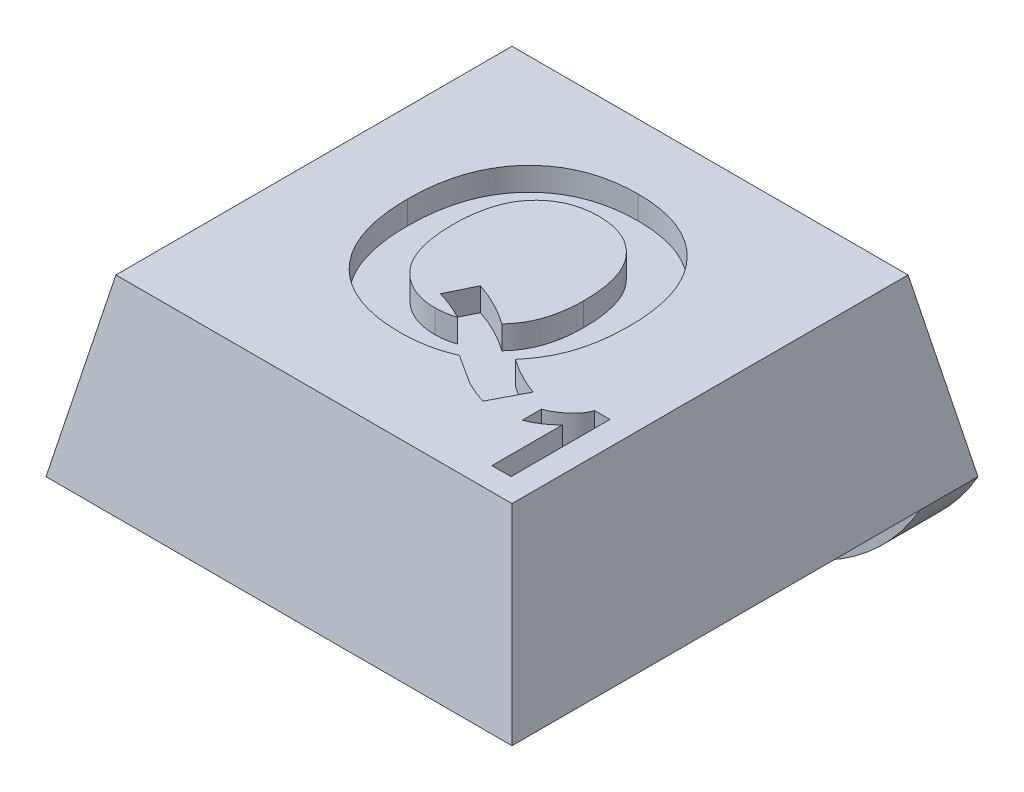
from build123d import *

# Parameters (mm, degrees)
SKETCH1_W               = 8
SKETCH1_H               = 8
BOSS_EXTRUDE1_DEPTH     = 3
CUT_EXTRUDE1_DEPTH      = 12.704699911
CUT_EXTRUDE1_DEPTH_BACK = 12.704699911
CUT_EXTRUDE2_DEPTH      = 11
SKETCH4_R               = 1.75
CUT_EXTRUDE3_DEPTH      = 0.4
SKETCH5_W               = 8
SKETCH5_H               = 1
BOSS_EXTRUDE2_DEPTH     = 2
FILLET1_R               = 4
CUT_EXTRUDE4_DEPTH      = 0.4
CUT_EXTRUDE5_DEPTH      = 0.5


with BuildPart() as part:
    # Sketch1 → Boss-Extrude1 (new body)
    with BuildSketch(Plane(origin=(0, 0, 0), x_dir=(1, 0, 0), z_dir=(0, 1, 0))):
        with Locations((4, 4)):
            Rectangle(SKETCH1_W, SKETCH1_H)
    extrude(amount=BOSS_EXTRUDE1_DEPTH)

    # Sketch2 → Cut-Extrude1 (cut, two sides: drawn at the far end of the back side and taken through both)
    with BuildSketch(Plane.XY.offset(-CUT_EXTRUDE1_DEPTH_BACK)):
        Polygon((0, 0), (0.6, 3), (0, 3), align=None)
        Polygon((8, 0), (7.4, 3), (8, 3), align=None)
    extrude(amount=CUT_EXTRUDE1_DEPTH + CUT_EXTRUDE1_DEPTH_BACK, mode=Mode.SUBTRACT)

    # Sketch3 → Cut-Extrude2 (cut)
    with BuildSketch(Plane(origin=(0, 0, 0), x_dir=(0, 0, -1), z_dir=(1, 0, 0))):
        Polygon((0, 0), (0.6, 3), (0, 3), align=None)
        Polygon((8, 3), (7.4, 3), (8, 0), align=None)
    extrude(amount=CUT_EXTRUDE2_DEPTH, mode=Mode.SUBTRACT)

    # Sketch4 → Cut-Extrude3 (cut)
    with BuildSketch(Plane.XZ):
        with Locations(Location((4, -3.75, 0), (0, 0, 270))):
            Circle(SKETCH4_R)
    extrude(amount=-CUT_EXTRUDE3_DEPTH, mode=Mode.SUBTRACT)

    # Sketch5 → Boss-Extrude2 (add)
    with BuildSketch(Plane.XZ):
        with Locations((4, -7.5)):
            Rectangle(SKETCH5_W, SKETCH5_H)
    extrude(amount=BOSS_EXTRUDE2_DEPTH)

    # Fillet1
    # the kernel refuses this fillet: 4 mm, written as the material it takes off along each edge
    with BuildSketch(Plane(origin=(8, -2, -16.660254038), x_dir=(0, 1, 0), z_dir=(0, 0, 1)), Plane(origin=(0, -2, 1.660254038), x_dir=(0, 1, 0), z_dir=(0, 0, -1))) as fillet1_piece_1:
        with BuildLine():
            CenterArc((4, 3.464101615), FILLET1_R, 180, 60)
            Line((0, 3.464101615), (-0.08, 3.464101615))
            Line((-0.08, 3.464101615), (-0.08, 0))
            Line((-0.08, 0), (0, -0.08))
            ThreePointArc((0, -0.08), (1, -0.08), (1.96, -0.069282032))
            Line((1.96, -0.069282032), (2, 0))
        make_face()
    extrude(amount=18.320508076, mode=Mode.SUBTRACT)

    # Sketch6 → Cut-Extrude4 (cut)
    with BuildSketch(Plane(origin=(0, 3, 0), x_dir=(1, 0, 0), z_dir=(0, 1, 0))):
        with BuildLine():
            add(Edge.make_bspline(
                [(5.284087955, 2.773445367), (5.333545491, 2.739545524), (5.432652736, 2.671614118), (5.590291823, 2.583736248), (5.752942084, 2.503846486), (5.865979951, 2.460876102), (5.92270975, 2.439310751)],
                knots=[0, 0, 0, 0, 0.994855506, 1.99357661, 2.993045438, 4, 4, 4, 4], degree=3))
            Line((5.92270975, 2.439310751), (5.628639237, 1.875208187))
            add(Edge.make_bspline(
                [(5.628639237, 1.875208187), (5.568520037, 1.893818156), (5.447325875, 1.93133395), (5.332925255, 1.986187111), (5.275273852, 2.013829982)],
                knots=[0, 0, 0, 0, 0.992113803, 2, 2, 2, 2], degree=3))
            add(Edge.make_bspline(
                [(5.275273852, 2.013829982), (5.26961656, 2.016684314), (5.253233801, 2.024950075), (5.223476786, 2.045298413), (5.178074812, 2.072724498), (5.118973761, 2.11071311), (5.045578888, 2.157800121), (4.95765273, 2.213934729), (4.856407872, 2.280704114), (4.783596416, 2.327731001), (4.744825134, 2.35277229)],
                knots=[0, 0, 0, 0, 0.241377655, 0.698997227, 1.371388316, 2.263975901, 3.376788369, 4.695767198, 6.240533187, 8, 8, 8, 8], degree=3))
            add(Edge.make_bspline(
                [(4.744825134, 2.35277229), (4.712670389, 2.339001865), (4.648050063, 2.311327899), (4.547788838, 2.27725121), (4.444978029, 2.248544986), (4.339982896, 2.224200245), (4.232359046, 2.206111381), (4.122258624, 2.192239309), (4.00937299, 2.18410397), (3.933139287, 2.183304154), (3.894664878, 2.182900495)],
                knots=[0, 0, 0, 0, 0.961025642, 1.931341354, 2.907359807, 3.893838693, 4.891829695, 5.905170566, 6.942759923, 8, 8, 8, 8], degree=3))
            add(Edge.make_bspline(
                [(3.894664878, 2.182900495), (3.821683976, 2.184676763), (3.679027131, 2.188148859), (3.471015208, 2.212756542), (3.275562804, 2.255408477), (3.091812023, 2.313667662), (2.920867424, 2.390147666), (2.761229426, 2.482594503), (2.615108223, 2.593406711), (2.480490537, 2.71918809), (2.361392609, 2.861354588), (2.257130725, 3.017424584), (2.168806746, 3.186880722), (2.097587685, 3.370615377), (2.041301668, 3.567142879), (2.002926315, 3.777850586), (1.978227581, 4.001488849), (1.975427333, 4.155321196), (1.973991801, 4.234182546)],
                knots=[0, 0, 0, 0, 1.098101164, 2.146474535, 3.146072545, 4.104420533, 5.041773038, 5.958565538, 6.874115049, 7.795336865, 8.725215067, 9.658214839, 10.614563411, 11.594512188, 12.618591104, 13.685899083, 14.813688224, 16, 16, 16, 16], degree=3))
            add(Edge.make_bspline(
                [(1.973991801, 4.234182546), (1.97543059, 4.313040679), (1.978227497, 4.466335509), (2.002757559, 4.689542909), (2.042412611, 4.899497801), (2.098124704, 5.096337583), (2.170410456, 5.279545107), (2.259079723, 5.449017762), (2.363505524, 5.605417057), (2.484015277, 5.747270094), (2.617919267, 5.874338646), (2.764464989, 5.984327234), (2.9219486, 6.078236158), (3.090996271, 6.154643933), (3.272074664, 6.212871015), (3.463805003, 6.255387163), (3.667248709, 6.280295733), (3.806454886, 6.283712517), (3.877837955, 6.285464598)],
                knots=[0, 0, 0, 0, 1.193283781, 2.319662245, 3.393996131, 4.424093603, 5.411284417, 6.369670503, 7.313761776, 8.251713527, 9.181123148, 10.102053383, 11.01932051, 11.951118596, 12.903560284, 13.893239571, 14.919681386, 16, 16, 16, 16], degree=3))
            add(Edge.make_bspline(
                [(3.877837955, 6.285464598), (3.948708316, 6.284176334), (4.086935049, 6.281663683), (4.288489067, 6.254790298), (4.478939684, 6.214016744), (4.658513444, 6.155241629), (4.826290277, 6.078911265), (4.983143341, 5.98623667), (5.128157857, 5.876434989), (5.26137487, 5.750578969), (5.380523981, 5.609215368), (5.486073462, 5.454669187), (5.572731816, 5.285035211), (5.645736122, 5.103191508), (5.700157026, 4.90736457), (5.740330715, 4.69867705), (5.764520815, 4.476471411), (5.76739165, 4.323719862), (5.768863596, 4.245400495)],
                knots=[0, 0, 0, 0, 1.078752742, 2.104017338, 3.091035458, 4.041673215, 4.975566109, 5.892967701, 6.810684895, 7.740128604, 8.678185021, 9.621404646, 10.583875016, 11.573429805, 12.6009998, 13.674031063, 14.80742018, 16, 16, 16, 16], degree=3))
            add(Edge.make_bspline(
                [(5.768863596, 4.245400495), (5.767275795, 4.16278925), (5.764189157, 4.002195454), (5.737326284, 3.768977018), (5.693780668, 3.550562854), (5.648918616, 3.41330904), (5.627036673, 3.346362034)],
                knots=[0, 0, 0, 0, 1.083667057, 2.106616435, 3.076482036, 4, 4, 4, 4], degree=3))
            add(Edge.make_bspline(
                [(5.627036673, 3.346362034), (5.607421404, 3.297050064), (5.567517691, 3.196733787), (5.488642668, 3.051933408), (5.394797316, 2.909076479), (5.321514211, 2.819296637), (5.284087955, 2.773445367)],
                knots=[0, 0, 0, 0, 0.948216854, 1.928975575, 2.942311585, 4, 4, 4, 4], degree=3))
        make_face()
        with BuildLine():
            add(Edge.make_bspline(
                [(4.642261032, 3.185304341), (4.671182259, 3.216922768), (4.72909393, 3.280235293), (4.800707281, 3.388678336), (4.863230922, 3.50497094), (4.912388312, 3.632014464), (4.951923574, 3.76787431), (4.97951585, 3.913560578), (4.996652709, 4.068707035), (4.998621406, 4.175375245), (4.999632827, 4.230176136)],
                knots=[0, 0, 0, 0, 0.906820982, 1.815812261, 2.745108282, 3.70056618, 4.696560745, 5.740060838, 6.83895416, 8, 8, 8, 8], degree=3))
            add(Edge.make_bspline(
                [(4.999632827, 4.230176136), (4.998745764, 4.286560817), (4.997027382, 4.395786947), (4.982794262, 4.554398979), (4.957747484, 4.70183414), (4.925058455, 4.838707416), (4.88052022, 4.963910999), (4.826807351, 5.078388614), (4.763835344, 5.182421929), (4.690056733, 5.274294514), (4.608907177, 5.355063587), (4.522159409, 5.426414517), (4.428546166, 5.486139657), (4.328544236, 5.534184829), (4.222990468, 5.571989212), (4.111634776, 5.59943433), (3.994225982, 5.615495039), (3.913944994, 5.6176829), (3.873030263, 5.618797931)],
                knots=[0, 0, 0, 0, 1.335693338, 2.587451293, 3.768164612, 4.876224393, 5.916940853, 6.910477009, 7.867661778, 8.790666633, 9.694493319, 10.576027549, 11.446684429, 12.318352473, 13.199023277, 14.098364444, 15.030842682, 16, 16, 16, 16], degree=3))
            add(Edge.make_bspline(
                [(3.873030263, 5.618797931), (3.831841607, 5.617719084), (3.751279942, 5.615608947), (3.633755604, 5.599158788), (3.522145798, 5.573035665), (3.416723766, 5.534932642), (3.316536446, 5.486796326), (3.222573421, 5.427181815), (3.134847786, 5.356951252), (3.053289548, 5.276692152), (2.980446173, 5.184790487), (2.915694165, 5.082568667), (2.862164439, 4.968850144), (2.819178201, 4.84427298), (2.784825228, 4.709477379), (2.760087026, 4.563739976), (2.745835322, 4.407279692), (2.744110931, 4.299383286), (2.74322257, 4.243797931)],
                knots=[0, 0, 0, 0, 0.980107447, 1.917010591, 2.819119613, 3.703969481, 4.579773866, 5.459928929, 6.346604172, 7.250235365, 8.177620171, 9.131899985, 10.124404622, 11.161948974, 12.264485933, 13.431998172, 14.677033863, 16, 16, 16, 16], degree=3))
            add(Edge.make_bspline(
                [(2.74322257, 4.243797931), (2.744089067, 4.187408458), (2.745771696, 4.077907007), (2.760333697, 3.91913972), (2.783941374, 3.771215716), (2.817547327, 3.634196218), (2.86051391, 3.507924697), (2.913437174, 3.392577112), (2.976036542, 3.288297709), (3.048513511, 3.196032652), (3.128245057, 3.114861766), (3.213441608, 3.04409835), (3.303411645, 2.983479498), (3.39857486, 2.934226809), (3.498956775, 2.896402137), (3.604207339, 2.869103357), (3.714939061, 2.852831885), (3.790443662, 2.850669982), (3.82895975, 2.849567162)],
                knots=[0, 0, 0, 0, 1.356840463, 2.634818045, 3.833173645, 4.958776583, 6.025986406, 7.038359119, 8.007356852, 8.946032033, 9.855123386, 10.740685277, 11.607120956, 12.460971081, 13.313368256, 14.183325659, 15.073285775, 16, 16, 16, 16], degree=3))
            add(Edge.make_bspline(
                [(3.82895975, 2.849567162), (3.857844622, 2.850073951), (3.914741814, 2.851072222), (3.998801079, 2.862293633), (4.080683558, 2.878515583), (4.133570622, 2.895033243), (4.159889237, 2.903253059)],
                knots=[0, 0, 0, 0, 1.028828871, 2.026578908, 3.017950568, 4, 4, 4, 4], degree=3))
            add(Edge.make_bspline(
                [(4.159889237, 2.903253059), (4.119539232, 2.924336443), (4.039635796, 2.966086993), (3.916101198, 3.019284802), (3.792319766, 3.067214804), (3.708133251, 3.09310976), (3.666299493, 3.105977418)],
                knots=[0, 0, 0, 0, 1.021704821, 2.023239566, 3.017713044, 4, 4, 4, 4], degree=3))
            Line((3.666299493, 3.105977418), (3.889857186, 3.56751588))
            add(Edge.make_bspline(
                [(3.889857186, 3.56751588), (3.955233958, 3.544923565), (4.086618506, 3.49952088), (4.276409331, 3.409366748), (4.463555304, 3.306758821), (4.582244486, 3.226093623), (4.642261032, 3.185304341)],
                knots=[0, 0, 0, 0, 0.979271047, 1.967993817, 2.972492781, 4, 4, 4, 4], degree=3))
        make_face(mode=Mode.SUBTRACT)
    extrude(amount=-CUT_EXTRUDE4_DEPTH, mode=Mode.SUBTRACT)

    # Sketch7 → Cut-Extrude5 (cut)
    with BuildSketch(Plane(origin=(0, 3, 0), x_dir=(1, 0, 0), z_dir=(0, 1, 0))):
        with BuildLine():
            Line((6.989609495, 0.992731968), (6.662686419, 0.992731968))
            Line((6.662686419, 0.992731968), (6.662686419, 2.203028442))
            add(Edge.make_bspline(
                [(6.662686419, 2.203028442), (6.647868508, 2.187985499), (6.618433709, 2.158103687), (6.571421698, 2.116422543), (6.522616062, 2.07764809), (6.471533827, 2.042148614), (6.418842766, 2.009418309), (6.364004407, 1.979715431), (6.307416238, 1.952628999), (6.268215163, 1.937491891), (6.248583854, 1.929911455)],
                knots=[0, 0, 0, 0, 1.012567276, 2.011397996, 3.011400399, 4.000747768, 4.993445519, 5.985067596, 6.990952157, 8, 8, 8, 8], degree=3))
            Line((6.248583854, 1.929911455), (6.248583854, 2.256834532))
            add(Edge.make_bspline(
                [(6.248583854, 2.256834532), (6.270355964, 2.264998139), (6.315923296, 2.282083933), (6.383165354, 2.318426283), (6.453350876, 2.363421778), (6.512310721, 2.40755194), (6.559122414, 2.44678718), (6.591840229, 2.478326157), (6.622155165, 2.510623705), (6.648927745, 2.544722271), (6.672860762, 2.579932457), (6.694066458, 2.616196741), (6.712732345, 2.65362968), (6.722503807, 2.679697149), (6.727389944, 2.692731968)],
                knots=[0, 0, 0, 0, 1.253673617, 2.623841347, 4.114270668, 5.751233548, 6.594491912, 7.409089316, 8.202422231, 8.983165545, 9.746111525, 10.498431446, 11.249153235, 12, 12, 12, 12], degree=3))
            Line((6.727389944, 2.692731968), (6.989609495, 2.692731968))
            Line((6.989609495, 2.692731968), (6.989609495, 0.992731968))
        make_face()
    extrude(amount=-CUT_EXTRUDE5_DEPTH, mode=Mode.SUBTRACT)


solid = part.part
